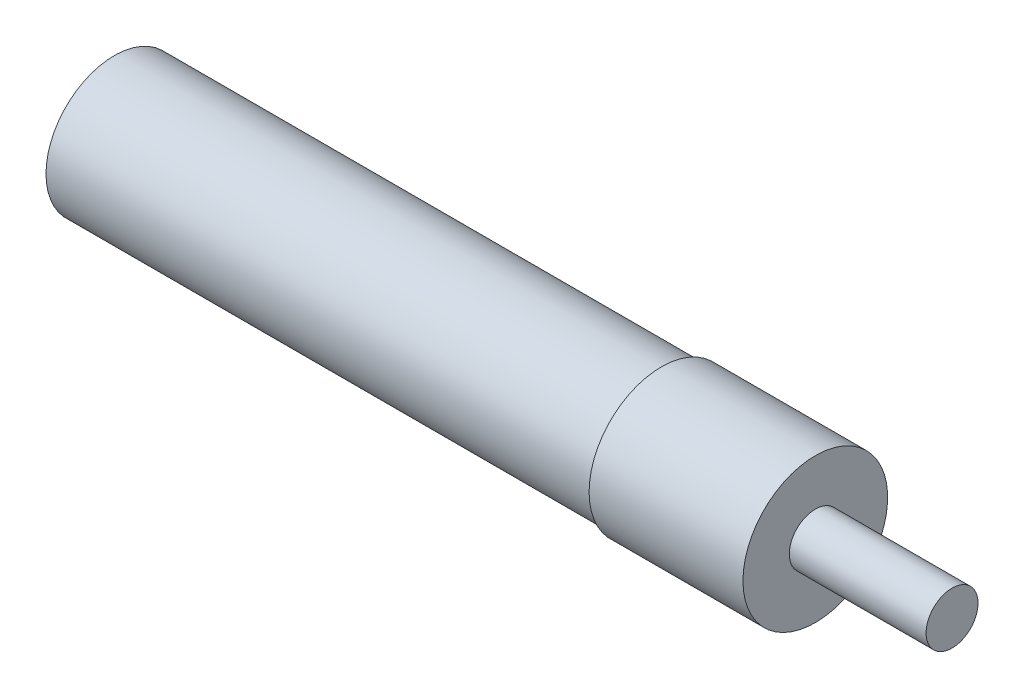
from build123d import *


with BuildPart() as part:
    # Sketch2 → Revolve1 (revolve)
    with BuildSketch(Plane.XY):
        Polygon((0, 0), (0, 6.35), (50.8, 6.35), (50.8, 6.7183), (65.0875, 6.7183), (65.0875, 2.413), (77.7875, 2.413), (77.7875, 0), align=None)
    revolve(axis=Axis((0, 0, 0), (1, 0, 0)))


solid = part.part
